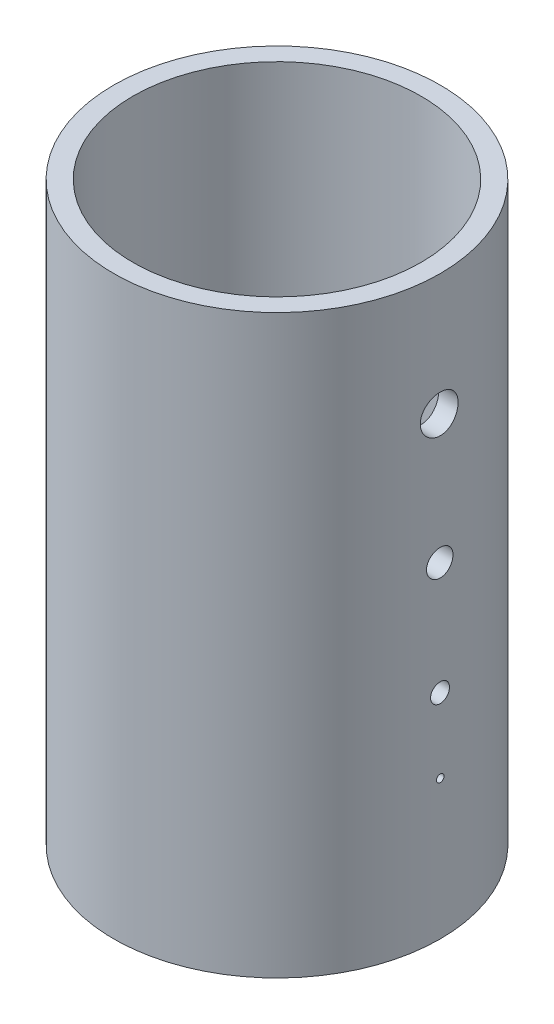
from build123d import *

# Parameters (mm, degrees)
CUT_EXTRUDE2_REACH = 182.412
SKETCH3_R          = 1
SKETCH3_R_2        = 2.5
SKETCH3_R_3        = 3.5
SKETCH3_R_4        = 5


with BuildPart() as part:
    # Sketch1 → Revolve1 (revolve)
    with BuildSketch(Plane.XY):
        with BuildLine():
            Line((0, 0), (-43.18, 0))
            Line((-43.18, 0), (-43.18, 152.4))
            Line((-43.18, 152.4), (-38.1, 152.4))
            Line((-38.1, 152.4), (-38.1, 34.925))
            ThreePointArc((-38.1, 34.925), (-30.660512242, 16.964487758), (-12.7, 9.525))
            Line((-12.7, 9.525), (0, 9.525))
            Line((0, 9.525), (0, 0))
        make_face()
    revolve(axis=Axis((0, 9.525, 0), (0, -1, 0)))

    # Sketch3 → Cut-Extrude2 (cut, up to next)
    with BuildSketch(Plane(origin=(43.18, 0, 0), x_dir=(0, 0, -1), z_dir=(1, 0, 0)), mode=Mode.PRIVATE) as cut_extrude2_sk1:
        with Locations((0, 36.807767203)):
            Circle(SKETCH3_R)
    cut_extrude2_tool1 = extrude(cut_extrude2_sk1.sketch, amount=-CUT_EXTRUDE2_REACH, mode=Mode.PRIVATE) & part.part
    # Sketch3 → Cut-Extrude2 (cut, up to next)
    with BuildSketch(Plane(origin=(43.18, 0, 0), x_dir=(0, 0, -1), z_dir=(1, 0, 0)), mode=Mode.PRIVATE) as cut_extrude2_sk2:
        with Locations((0, 56.415531495)):
            Circle(SKETCH3_R_2)
    cut_extrude2_tool2 = extrude(cut_extrude2_sk2.sketch, amount=-CUT_EXTRUDE2_REACH, mode=Mode.PRIVATE) & part.part
    # Sketch3 → Cut-Extrude2 (cut, up to next)
    with BuildSketch(Plane(origin=(43.18, 0, 0), x_dir=(0, 0, -1), z_dir=(1, 0, 0)), mode=Mode.PRIVATE) as cut_extrude2_sk3:
        with Locations((0, 86.184062586)):
            Circle(SKETCH3_R_3)
    cut_extrude2_tool3 = extrude(cut_extrude2_sk3.sketch, amount=-CUT_EXTRUDE2_REACH, mode=Mode.PRIVATE) & part.part
    # Sketch3 → Cut-Extrude2 (cut, up to next)
    with BuildSketch(Plane(origin=(43.18, 0, 0), x_dir=(0, 0, -1), z_dir=(1, 0, 0)), mode=Mode.PRIVATE) as cut_extrude2_sk4:
        with Locations((0, 120.2597856)):
            Circle(SKETCH3_R_4)
    cut_extrude2_tool4 = extrude(cut_extrude2_sk4.sketch, amount=-CUT_EXTRUDE2_REACH, mode=Mode.PRIVATE) & part.part
    add(cut_extrude2_tool1.solids().sort_by_distance((43.18, 36.807767, 0))[0], mode=Mode.SUBTRACT)
    add(cut_extrude2_tool2.solids().sort_by_distance((43.18, 56.415531, 0))[0], mode=Mode.SUBTRACT)
    add(cut_extrude2_tool3.solids().sort_by_distance((43.18, 86.184063, 0))[0], mode=Mode.SUBTRACT)
    add(cut_extrude2_tool4.solids().sort_by_distance((43.18, 120.259786, 0))[0], mode=Mode.SUBTRACT)


solid = part.part
